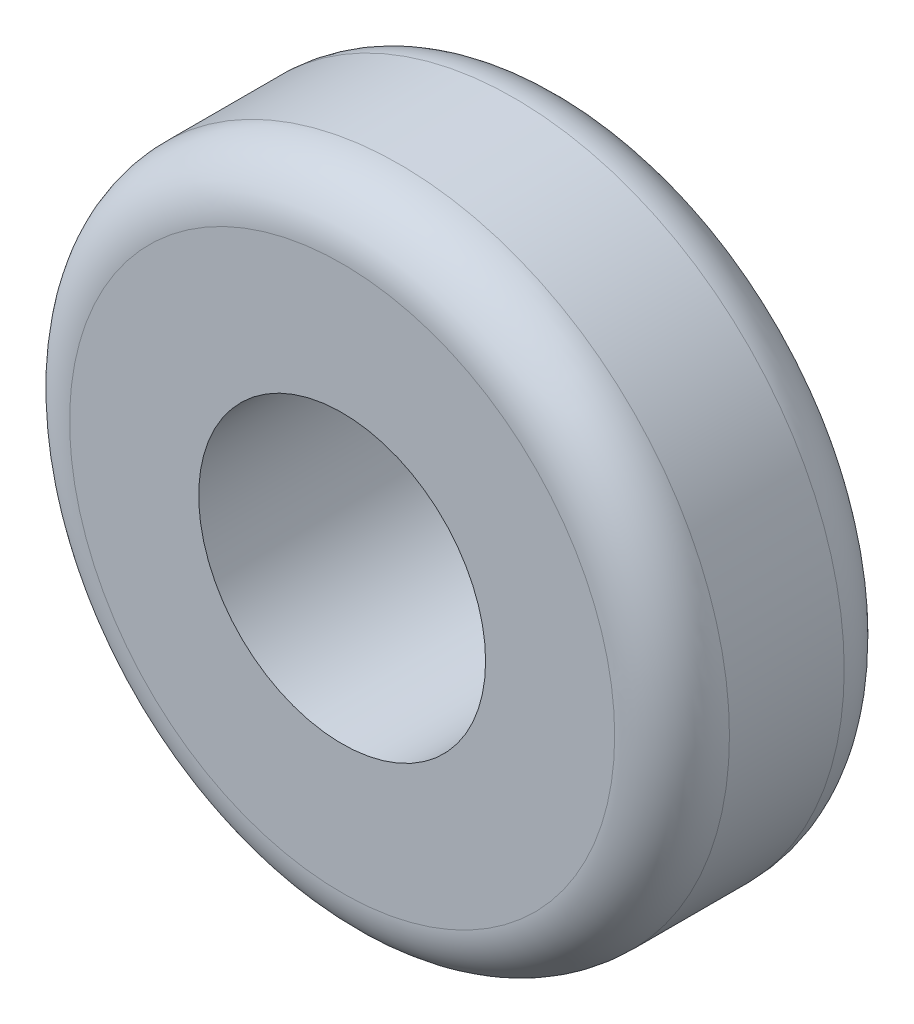
from build123d import *

# Parameters (mm, degrees)
SKETCH2_R           = 8.625
SKETCH2_R_2         = 3.75
BOSS_EXTRUDE1_DEPTH = 3
FILLET1_R           = 1.5


with BuildPart() as part:
    # Sketch2 → Boss-Extrude1 (new, symmetric)
    with BuildSketch(Plane.XY):
        Circle(SKETCH2_R)
        Circle(SKETCH2_R_2, mode=Mode.SUBTRACT)
    extrude(amount=BOSS_EXTRUDE1_DEPTH, both=True)

    # Fillet1
    fillet1_edges = [part.edges().sort_by_distance(p)[0] for p in [
        (-8.625, 0, -3),
        (-8.625, 0, 3),
    ]]
    fillet(fillet1_edges, radius=FILLET1_R)


solid = part.part
